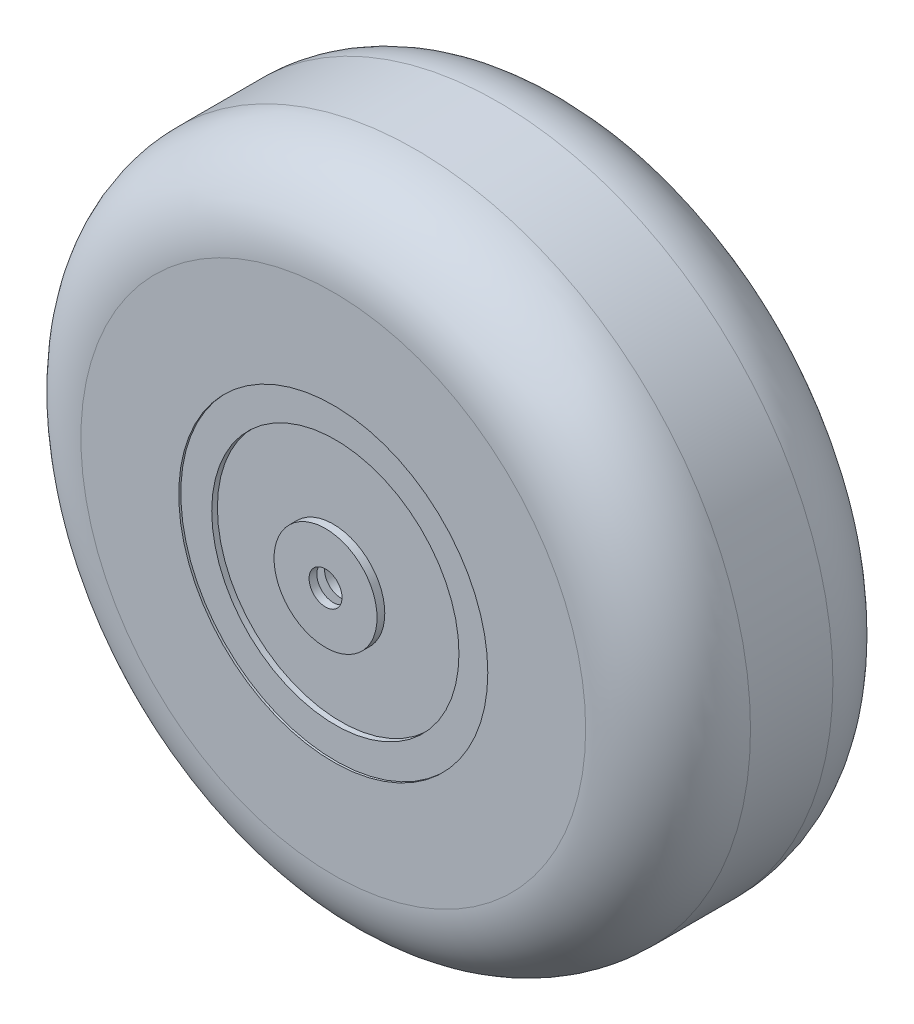
from build123d import *

# Parameters (mm, degrees)
SKETCH1_R           = 32.5
SKETCH1_R_2         = 1.6
BOSS_EXTRUDE1_DEPTH = 24
FILLET2_R           = 8
SKETCH3_R           = 5
BOSS_EXTRUDE2_DEPTH = 0.75
BOSS_EXTRUDE3_START = 0.75
SKETCH4_R           = 5
BOSS_EXTRUDE3_DEPTH = 0.75
SKETCH5_R           = 1.6
CUT_EXTRUDE1_DEPTH  = 40.75
SKETCH6_R           = 15
SKETCH6_R_2         = 12
CUT_EXTRUDE3_DEPTH  = 0.2
CUT_EXTRUDE5_START  = -0.75
SKETCH9_R           = 12
CUT_EXTRUDE5_DEPTH  = 0.75
SKETCH11_R          = 12
CUT_EXTRUDE6_DEPTH  = 0.75
SKETCH12_R          = 15
SKETCH12_R_2        = 12
CUT_EXTRUDE7_DEPTH  = 0.75


with BuildPart() as part:
    # Sketch1 → Boss-Extrude1 (new body)
    with BuildSketch(Plane.XY):
        Circle(SKETCH1_R)
        Circle(SKETCH1_R_2, mode=Mode.SUBTRACT)
    extrude(amount=BOSS_EXTRUDE1_DEPTH)

    # Fillet2
    fillet2_edges = [part.edges().sort_by_distance(p)[0] for p in [
        (-32.5, 0, 0),
        (-32.5, 0, 24),
    ]]
    fillet(fillet2_edges, radius=FILLET2_R)

    # Sketch3 → Boss-Extrude2 (add)
    with BuildSketch(Plane.XY.offset(24)):
        Circle(SKETCH3_R)
    extrude(amount=BOSS_EXTRUDE2_DEPTH)

    # Sketch4 → Boss-Extrude3 (add)
    with BuildSketch(Plane(origin=(0, 0, 0), x_dir=(-1, 0, 0), z_dir=(0, 0, -1)).offset(BOSS_EXTRUDE3_START)):
        Circle(SKETCH4_R)
    extrude(amount=-BOSS_EXTRUDE3_DEPTH)

    # Sketch5 → Cut-Extrude1 (cut)
    with BuildSketch(Plane(origin=(0, 0, -0.75), x_dir=(-1, 0, 0), z_dir=(0, 0, -1))):
        Circle(SKETCH5_R)
    extrude(amount=-CUT_EXTRUDE1_DEPTH, mode=Mode.SUBTRACT)

    # Sketch6 → Cut-Extrude3 (cut)
    with BuildSketch(Plane.XY.offset(24)):
        Circle(SKETCH6_R)
        Circle(SKETCH6_R_2, mode=Mode.SUBTRACT)
    extrude(amount=-CUT_EXTRUDE3_DEPTH, mode=Mode.SUBTRACT)

    # Sketch9 → Cut-Extrude5 (cut)
    with BuildSketch(Plane(origin=(0, 0, 0), x_dir=(-1, 0, 0), z_dir=(0, 0, -1)).offset(CUT_EXTRUDE5_START)):
        Circle(SKETCH9_R)
    extrude(amount=CUT_EXTRUDE5_DEPTH, mode=Mode.SUBTRACT)


with BuildPart() as cut_extrude5_piece_1:
    # of the separate pieces the step leaves, piece 1, a body of its own (cut_extrude5_pieces)
    add(part.part.solids().sort_by_distance((32.5, 0, 8))[0])

    # Sketch11 → Cut-Extrude6 (cut)
    with BuildSketch(Plane.XY.offset(24)):
        Circle(SKETCH11_R)
    extrude(amount=-CUT_EXTRUDE6_DEPTH, mode=Mode.SUBTRACT)


with BuildPart() as cut_extrude5_piece_2:
    # of the separate pieces the step leaves, piece 2, a body of its own (cut_extrude5_pieces)
    add(part.part.solids().sort_by_distance((-5, 0, -0.75))[0])


with BuildPart() as cut_extrude6_piece_1:
    # of the separate pieces the step leaves, piece 1, a body of its own (cut_extrude6_pieces)
    add(cut_extrude5_piece_1.part.solids().sort_by_distance((32.5, 0, 8))[0])

    # Sketch12 → Cut-Extrude7 (cut)
    with BuildSketch(Plane(origin=(0, 0, 0), x_dir=(-1, 0, 0), z_dir=(0, 0, -1))):
        Circle(SKETCH12_R)
        Circle(SKETCH12_R_2, mode=Mode.SUBTRACT)
    extrude(amount=-CUT_EXTRUDE7_DEPTH, mode=Mode.SUBTRACT)


with BuildPart() as cut_extrude6_piece_2:
    # of the separate pieces the step leaves, piece 2, a body of its own (cut_extrude6_pieces)
    add(cut_extrude5_piece_1.part.solids().sort_by_distance((-1.6, 0, 24))[0])


solid = Compound([cut_extrude5_piece_2.part, cut_extrude6_piece_1.part, cut_extrude6_piece_2.part])
